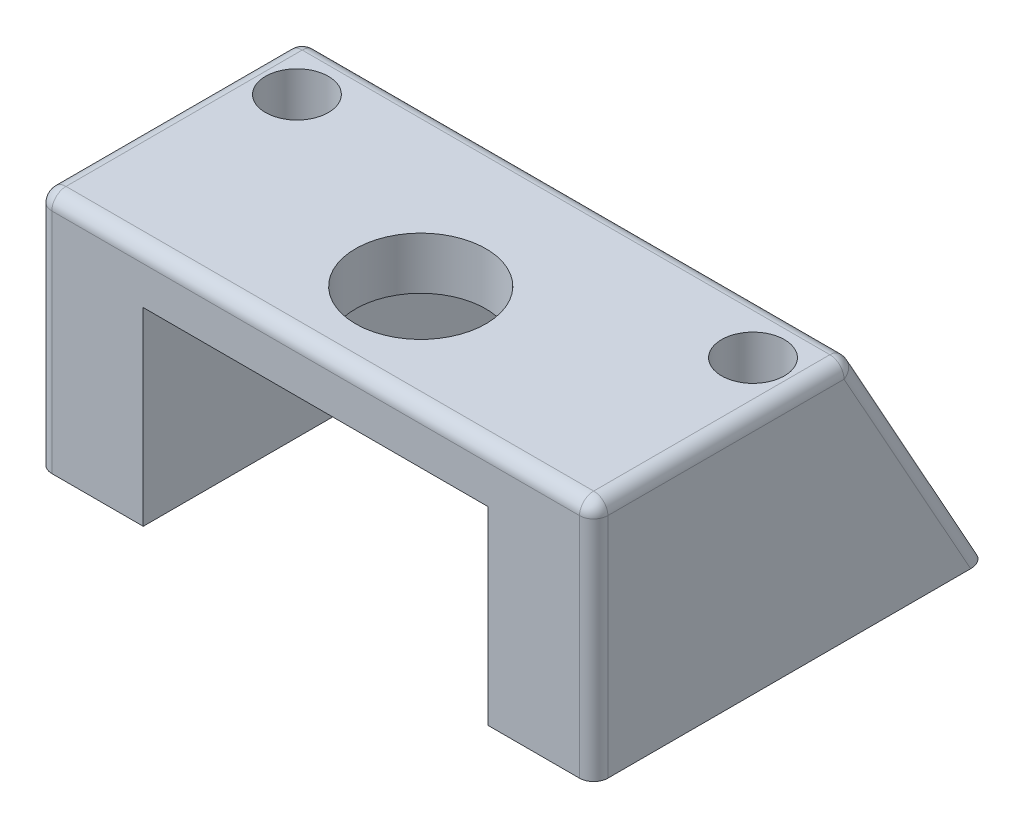
from build123d import *
from build123d.topology import SkipClean

# Parameters (mm, degrees)
BOSS_EXTRUDE1_DEPTH             = 21.336
CUT_EXTRUDE1_DEPTH              = 28.727459508
CUT_EXTRUDE1_DEPTH_BACK         = 28.727459508
SKETCH2_W                       = 26.4668
SKETCH2_H                       = 14.542
FILLET1_R                       = 1.08735749
CUT_EXTRUDE2_DEPTH              = 28.727459508
CUT_EXTRUDE2_DEPTH_BACK         = 28.727459508
SKETCH3_R                       = 5
CUT_EXTRUDE3_START              = -9.271
CUT_EXTRUDE3_DEPTH              = 16.9672
CUT_EXTRUDE4_REACH              = 44.487
CUT_EXTRUDE4_DIRECTION_2_REACH  = 44.487
BOSS_EXTRUDE2_START             = -9.271
BOSS_EXTRUDE2_DEPTH             = 16.9672
BOSS_EXTRUDE3_REACH             = 44.487
BOSS_EXTRUDE3_DIRECTION_2_REACH = 44.487
CUT_EXTRUDE5_START              = -9.271
CUT_EXTRUDE5_DEPTH              = 8.001
CUT_EXTRUDE6_DEPTH              = 2.96394251
CUT_EXTRUDE7_REACH              = 29.727
CUT_EXTRUDE7_DIRECTION_2_REACH  = 29.727
BOSS_EXTRUDE5_START             = 5.271
SKETCH11_W                      = 1.6256
SKETCH11_H                      = 1.117047559
BOSS_EXTRUDE5_DEPTH             = 2.0066
SKETCH14_R                      = 2.413
CUT_EXTRUDE8_DEPTH              = 9.3472
CUT_EXTRUDE9_REACH              = 29.753
SKETCH15_R                      = 1.143


with BuildPart() as part:
    # Sketch1 → Boss-Extrude1 (new, symmetric)
    with BuildSketch(Plane(origin=(0, 0, 0), x_dir=(0, 0, -1), z_dir=(1, 0, 0))):
        Polygon((-15.0876, -9.271), (15.0876, -9.271), (4.76551496, 9.271), (-15.0876, 9.271), align=None)
    extrude(amount=BOSS_EXTRUDE1_DEPTH, both=True)

    # Sketch2 → Cut-Extrude1 (cut, two sides: drawn at the far end of the back side and taken through both)
    with BuildSketch(Plane.XY.offset(-CUT_EXTRUDE1_DEPTH_BACK)):
        with Locations((0, -2)):
            Rectangle(SKETCH2_W, SKETCH2_H)
    extrude(amount=CUT_EXTRUDE1_DEPTH + CUT_EXTRUDE1_DEPTH_BACK, mode=Mode.SUBTRACT)

    # Fillet1
    fillet1_edges = [part.edges().sort_by_distance(p)[0] for p in [
        (21.336, 0, 15.0876),
        (21.336, 0, -9.92655748),
        (-21.336, 0, 15.0876),
        (-21.336, 9.271, 5.16104252),
        (-21.336, 0, -9.92655748),
        (21.336, 9.271, 5.16104252),
        (0, 9.271, 15.0876),
        (0, 9.271, -4.76551496),
    ]]
    fillet(fillet1_edges, radius=FILLET1_R)

    # Sketch3 → Cut-Extrude2 (cut, two sides: drawn at the far end of the back side and taken through both)
    with BuildSketch(Plane(origin=(0, 0, 0), x_dir=(1, 0, 0), z_dir=(0, 1, 0)).offset(-CUT_EXTRUDE2_DEPTH_BACK)):
        with Locations(Location((0, -7.025, 0), (0, 0, 270))):
            Circle(SKETCH3_R)
    extrude(amount=CUT_EXTRUDE2_DEPTH + CUT_EXTRUDE2_DEPTH_BACK, mode=Mode.SUBTRACT)

    # Sketch4 → Cut-Extrude3 (cut)
    with BuildSketch(Plane(origin=(0, 0, 0), x_dir=(1, 0, 0), z_dir=(0, 1, 0)).offset(CUT_EXTRUDE3_START)):
        with BuildLine():
            Line((-20.24864251, -14.00024251), (-14.32075749, -14.00024251))
            Line((-14.32075749, -14.00024251), (-14.32075749, 3.339958947))
            ThreePointArc((-14.32075749, 3.339958947), (-17.174184705, 4.923981914), (-20.24864251, 3.82904592))
            Line((-20.24864251, 3.82904592), (-20.24864251, -14.00024251))
        make_face()
    extrude(amount=CUT_EXTRUDE3_DEPTH, mode=Mode.SUBTRACT)

    # Cut-Extrude4: up to this face of the body (flat: up to its plane)
    cut_extrude4_end = Plane(part.part.faces().sort_by_distance((-14.32075749, -0.7874, 5.330141781))[0])
    # Sketch7 → Cut-Extrude4 (cut, up to the picked face)
    with BuildSketch(Plane.ZY.offset(17.2847), mode=Mode.PRIVATE) as cut_extrude4_sk1:
        Polygon((-3.339958947, -9.271), (-13.843109925, -9.271), (-4.397695121, 7.6962), (-3.339958947, 7.6962), align=None)
    cut_extrude4_tool1 = split(extrude(cut_extrude4_sk1.sketch, amount=-CUT_EXTRUDE4_REACH, mode=Mode.PRIVATE), bisect_by=cut_extrude4_end, keep=Keep.BOTH, mode=Mode.PRIVATE)
    add(cut_extrude4_tool1.solids().sort_by(Axis((-17.2847, -3.097809, -6.873268), (1, 0, 0)))[0], mode=Mode.SUBTRACT)

    # Cut-Extrude4 direction 2: up to this face of the body (flat: up to its plane)
    cut_extrude4_direction_2_end = Plane(part.part.faces().sort_by_distance((-20.24864251, -0.7874, 5.085598295))[0])
    # Sketch7 → Cut-Extrude4 direction 2 (cut, up to the picked face)
    with BuildSketch(Plane.ZY.offset(17.2847), mode=Mode.PRIVATE) as cut_extrude4_direction_2_sk1:
        Polygon((-3.339958947, -9.271), (-13.843109925, -9.271), (-4.397695121, 7.6962), (-3.339958947, 7.6962), align=None)
    cut_extrude4_direction_2_tool1 = split(extrude(cut_extrude4_direction_2_sk1.sketch, amount=CUT_EXTRUDE4_DIRECTION_2_REACH, mode=Mode.PRIVATE), bisect_by=cut_extrude4_direction_2_end, keep=Keep.BOTH, mode=Mode.PRIVATE)
    add(cut_extrude4_direction_2_tool1.solids().sort_by(Axis((-17.2847, -3.097809, -6.873268), (-1, 0, 0)))[0], mode=Mode.SUBTRACT)

    # Sketch4<3> → Boss-Extrude2 (add)
    with BuildSketch(Plane(origin=(0, 0, 0), x_dir=(1, 0, 0), z_dir=(0, 1, 0)).offset(BOSS_EXTRUDE2_START)):
        with BuildLine():
            Line((-20.24864251, 3.82904592), (-20.24864251, -1.87904592))
            ThreePointArc((-20.24864251, -1.87904592), (-17.174184705, -2.973981914), (-14.32075749, -1.389958947))
            Line((-14.32075749, -1.389958947), (-14.32075749, 3.339958947))
            ThreePointArc((-14.32075749, 3.339958947), (-17.174184705, 4.923981914), (-20.24864251, 3.82904592))
        make_face()
    boss_extrude2 = extrude(amount=BOSS_EXTRUDE2_DEPTH)

    # Boss-Extrude3: up to this face of the body (flat: up to its plane)
    boss_extrude3_end = Plane(part.part.faces().sort_by_distance((-14.32075749, -0.7874, 7.695100729))[0])
    # Sketch8 → Boss-Extrude3 (add, up to the picked face)
    with BuildSketch(Plane.ZY.offset(17.2847), mode=Mode.PRIVATE) as boss_extrude3_sk1:
        Polygon((-3.82904592, 7.6962), (-4.397695121, 7.6962), (-13.843109925, -9.271), (-3.339958947, 7.6962), align=None)
    boss_extrude3_tool1 = split(extrude(boss_extrude3_sk1.sketch, amount=-BOSS_EXTRUDE3_REACH, mode=Mode.PRIVATE), bisect_by=boss_extrude3_end, keep=Keep.BOTH, mode=Mode.PRIVATE)
    add(boss_extrude3_tool1.solids().sort_by(Axis((-17.2847, 2.040467, -7.193588), (1, 0, 0)))[0])

    # Boss-Extrude3 direction 2: up to this face of the body (flat: up to its plane)
    boss_extrude3_direction_2_end = Plane(part.part.faces().sort_by_distance((-20.24864251, -0.7874, 7.939644215))[0])
    # Sketch8 → Boss-Extrude3 direction 2 (add, up to the picked face)
    with BuildSketch(Plane.ZY.offset(17.2847), mode=Mode.PRIVATE) as boss_extrude3_direction_2_sk1:
        Polygon((-3.82904592, 7.6962), (-4.397695121, 7.6962), (-13.843109925, -9.271), (-3.339958947, 7.6962), align=None)
    boss_extrude3_direction_2_tool1 = split(extrude(boss_extrude3_direction_2_sk1.sketch, amount=BOSS_EXTRUDE3_DIRECTION_2_REACH, mode=Mode.PRIVATE), bisect_by=boss_extrude3_direction_2_end, keep=Keep.BOTH, mode=Mode.PRIVATE)
    add(boss_extrude3_direction_2_tool1.solids().sort_by(Axis((-17.2847, 2.040467, -7.193588), (-1, 0, 0)))[0])

    # Sketch4<4> → Cut-Extrude5 (cut)
    with BuildSketch(Plane(origin=(0, 0, 0), x_dir=(1, 0, 0), z_dir=(0, 1, 0)).offset(CUT_EXTRUDE5_START)):
        with BuildLine():
            ThreePointArc((-18.111184511, -1.324462975), (-18.042197414, -1.424488299), (-17.932195062, -1.4761))
            ThreePointArc((-17.932195062, -1.4761), (-17.811174423, -1.465223885), (-17.712137081, -1.394825803))
            ThreePointArc((-17.712137081, -1.394825803), (-17.617293446, -1.320975793), (-17.5, -1.294681563))
            ThreePointArc((-17.5, -1.294681563), (-17.382706554, -1.320975793), (-17.287862919, -1.394825803))
            ThreePointArc((-17.287862919, -1.394825803), (-17.188825577, -1.465223885), (-17.067804938, -1.4761))
            ThreePointArc((-17.067804938, -1.4761), (-16.957802586, -1.424488299), (-16.888815489, -1.324462975))
            ThreePointArc((-16.888815489, -1.324462975), (-16.824949816, -1.222628232), (-16.723723187, -1.157803016))
            ThreePointArc((-16.723723187, -1.157803016), (-16.604510244, -1.142394789), (-16.490128189, -1.179352665))
            ThreePointArc((-16.490128189, -1.179352665), (-16.372985968, -1.211632457), (-16.255543916, -1.180461166))
            ThreePointArc((-16.255543916, -1.180461166), (-16.16982776, -1.094339011), (-16.139211769, -0.976750975))
            ThreePointArc((-16.139211769, -0.976750975), (-16.114027201, -0.859214272), (-16.041076813, -0.763676949))
            ThreePointArc((-16.041076813, -0.763676949), (-15.934323215, -0.708424724), (-15.814198904, -0.704032801))
            ThreePointArc((-15.814198904, -0.704032801), (-15.693080884, -0.694300883), (-15.593382664, -0.624841903))
            ThreePointArc((-15.593382664, -0.624841903), (-15.542291336, -0.514596898), (-15.553739192, -0.393629003))
            ThreePointArc((-15.553739192, -0.393629003), (-15.57027336, -0.274567001), (-15.534398108, -0.159840781))
            ThreePointArc((-15.534398108, -0.159840781), (-15.452979913, -0.071408793), (-15.341602111, -0.0261968))
            ThreePointArc((-15.341602111, -0.0261968), (-15.231116913, 0.024373013), (-15.161187602, 0.123741903))
            ThreePointArc((-15.161187602, 0.123741903), (-15.15088347, 0.244812585), (-15.203014393, 0.354569826))
            ThreePointArc((-15.203014393, 0.354569826), (-15.259273031, 0.460796492), (-15.2648, 0.580873933))
            ThreePointArc((-15.2648, 0.580873933), (-15.218537445, 0.691819483), (-15.129339958, 0.77239831))
            ThreePointArc((-15.129339958, 0.77239831), (-15.042813727, 0.857706554), (-15.011087832, 0.975))
            ThreePointArc((-15.011087832, 0.975), (-15.042813727, 1.092293446), (-15.129339958, 1.17760169))
            ThreePointArc((-15.129339958, 1.17760169), (-15.218537445, 1.258180517), (-15.2648, 1.369126067))
            ThreePointArc((-15.2648, 1.369126067), (-15.259273031, 1.489203508), (-15.203014393, 1.595430174))
            ThreePointArc((-15.203014393, 1.595430174), (-15.15088347, 1.705187415), (-15.161187602, 1.826258097))
            ThreePointArc((-15.161187602, 1.826258097), (-15.231116913, 1.925626987), (-15.341602111, 1.9761968))
            ThreePointArc((-15.341602111, 1.9761968), (-15.452979913, 2.021408793), (-15.534398108, 2.109840781))
            ThreePointArc((-15.534398108, 2.109840781), (-15.57027336, 2.224567001), (-15.553739192, 2.343629003))
            ThreePointArc((-15.553739192, 2.343629003), (-15.542291336, 2.464596898), (-15.593382664, 2.574841903))
            ThreePointArc((-15.593382664, 2.574841903), (-15.693080884, 2.644300883), (-15.814198904, 2.654032801))
            ThreePointArc((-15.814198904, 2.654032801), (-15.934323215, 2.658424724), (-16.041076813, 2.713676949))
            ThreePointArc((-16.041076813, 2.713676949), (-16.114027201, 2.809214272), (-16.139211769, 2.926750975))
            ThreePointArc((-16.139211769, 2.926750975), (-16.16982776, 3.044339011), (-16.255543916, 3.130461166))
            ThreePointArc((-16.255543916, 3.130461166), (-16.372985968, 3.161632457), (-16.490128189, 3.129352665))
            ThreePointArc((-16.490128189, 3.129352665), (-16.604510244, 3.092394789), (-16.723723187, 3.107803016))
            ThreePointArc((-16.723723187, 3.107803016), (-16.824949816, 3.172628232), (-16.888815489, 3.274462975))
            ThreePointArc((-16.888815489, 3.274462975), (-16.957802586, 3.374488299), (-17.067804938, 3.4261))
            ThreePointArc((-17.067804938, 3.4261), (-17.188825577, 3.415223885), (-17.287862919, 3.344825803))
            ThreePointArc((-17.287862919, 3.344825803), (-17.382706554, 3.270975793), (-17.5, 3.244681563))
            ThreePointArc((-17.5, 3.244681563), (-17.617293446, 3.270975793), (-17.712137081, 3.344825803))
            ThreePointArc((-17.712137081, 3.344825803), (-17.811174423, 3.415223885), (-17.932195062, 3.4261))
            ThreePointArc((-17.932195062, 3.4261), (-18.042197414, 3.374488299), (-18.111184511, 3.274462975))
            ThreePointArc((-18.111184511, 3.274462975), (-18.175050184, 3.172628232), (-18.276276813, 3.107803016))
            ThreePointArc((-18.276276813, 3.107803016), (-18.395489756, 3.092394789), (-18.509871811, 3.129352665))
            ThreePointArc((-18.509871811, 3.129352665), (-18.627014032, 3.161632457), (-18.744456084, 3.130461166))
            ThreePointArc((-18.744456084, 3.130461166), (-18.83017224, 3.044339011), (-18.860788231, 2.926750975))
            ThreePointArc((-18.860788231, 2.926750975), (-18.885972799, 2.809214272), (-18.958923187, 2.713676949))
            ThreePointArc((-18.958923187, 2.713676949), (-19.065676785, 2.658424724), (-19.185801096, 2.654032801))
            ThreePointArc((-19.185801096, 2.654032801), (-19.306919116, 2.644300883), (-19.406617336, 2.574841903))
            ThreePointArc((-19.406617336, 2.574841903), (-19.457708664, 2.464596898), (-19.446260808, 2.343629003))
            ThreePointArc((-19.446260808, 2.343629003), (-19.42972664, 2.224567001), (-19.465601892, 2.109840781))
            ThreePointArc((-19.465601892, 2.109840781), (-19.547020087, 2.021408793), (-19.658397889, 1.9761968))
            ThreePointArc((-19.658397889, 1.9761968), (-19.768883087, 1.925626987), (-19.838812398, 1.826258097))
            ThreePointArc((-19.838812398, 1.826258097), (-19.84911653, 1.705187415), (-19.796985607, 1.595430174))
            ThreePointArc((-19.796985607, 1.595430174), (-19.740726969, 1.489203508), (-19.7352, 1.369126067))
            ThreePointArc((-19.7352, 1.369126067), (-19.781462555, 1.258180517), (-19.870660042, 1.17760169))
            ThreePointArc((-19.870660042, 1.17760169), (-19.957186273, 1.092293446), (-19.988912168, 0.975))
            ThreePointArc((-19.988912168, 0.975), (-19.957186273, 0.857706554), (-19.870660042, 0.77239831))
            ThreePointArc((-19.870660042, 0.77239831), (-19.781462555, 0.691819483), (-19.7352, 0.580873933))
            ThreePointArc((-19.7352, 0.580873933), (-19.740726969, 0.460796492), (-19.796985607, 0.354569826))
            ThreePointArc((-19.796985607, 0.354569826), (-19.84911653, 0.244812585), (-19.838812398, 0.123741903))
            ThreePointArc((-19.838812398, 0.123741903), (-19.768883087, 0.024373013), (-19.658397889, -0.0261968))
            ThreePointArc((-19.658397889, -0.0261968), (-19.547020087, -0.071408793), (-19.465601892, -0.159840781))
            ThreePointArc((-19.465601892, -0.159840781), (-19.42972664, -0.274567001), (-19.446260808, -0.393629003))
            ThreePointArc((-19.446260808, -0.393629003), (-19.457708664, -0.514596898), (-19.406617336, -0.624841903))
            ThreePointArc((-19.406617336, -0.624841903), (-19.306919116, -0.694300883), (-19.185801096, -0.704032801))
            ThreePointArc((-19.185801096, -0.704032801), (-19.065676785, -0.708424724), (-18.958923187, -0.763676949))
            ThreePointArc((-18.958923187, -0.763676949), (-18.885972799, -0.859214272), (-18.860788231, -0.976750975))
            ThreePointArc((-18.860788231, -0.976750975), (-18.83017224, -1.094339011), (-18.744456084, -1.180461166))
            ThreePointArc((-18.744456084, -1.180461166), (-18.627014032, -1.211632457), (-18.509871811, -1.179352665))
            ThreePointArc((-18.509871811, -1.179352665), (-18.395489756, -1.142394789), (-18.276276813, -1.157803016))
            ThreePointArc((-18.276276813, -1.157803016), (-18.175050184, -1.222628232), (-18.111184511, -1.324462975))
        make_face()
    cut_extrude5 = extrude(amount=CUT_EXTRUDE5_DEPTH, mode=Mode.SUBTRACT)

    # Sketch9 → Cut-Extrude6 (cut, symmetric)
    with BuildSketch(Plane.ZY.offset(-17.2847)):
        Polygon((-13.843109925, -9.271), (-3.339958947, 7.6962), (1.389958947, 7.6962), (14.00024251, 7.6962), (14.00024251, -9.271), align=None)
    extrude(amount=CUT_EXTRUDE6_DEPTH, both=True, mode=Mode.SUBTRACT)

    # Mirror7: Boss-Extrude2 across plane
    add(boss_extrude2.mirror(Plane(origin=(0, 0, 0), x_dir=(0, 0, 1), z_dir=(1, 0, 0))))

    # Mirror8: Cut-Extrude5 across plane
    add(cut_extrude5.mirror(Plane(origin=(0, 0, 0), x_dir=(0, 0, 1), z_dir=(1, 0, 0))), mode=Mode.SUBTRACT)

    # Cut-Extrude7: up to this face of the body (flat: up to its plane)
    cut_extrude7_end = Plane(part.part.faces().sort_by_distance((-13.2334, -2.375473698, 1.919323937))[0])
    # Sketch12 → Cut-Extrude7 (cut, up to the picked face)
    with BuildSketch(Plane(origin=(0, 0, 0), x_dir=(0, 0, -1), z_dir=(1, 0, 0)), mode=Mode.PRIVATE) as cut_extrude7_sk1:
        Polygon((13.843109925, -9.271), (4.630724179, 7.2776), (-14.00024251, 7.2776), (-14.00024251, -9.271), align=None)
    cut_extrude7_tool1 = split(extrude(cut_extrude7_sk1.sketch, amount=-CUT_EXTRUDE7_REACH, mode=Mode.PRIVATE), bisect_by=cut_extrude7_end, keep=Keep.BOTH, mode=Mode.PRIVATE)
    add(cut_extrude7_tool1.solids().sort_by(Axis((0, -1.543425, 2.229485), (-1, 0, 0)))[0], mode=Mode.SUBTRACT)

    # Cut-Extrude7 direction 2: up to this face of the body (flat: up to its plane)
    cut_extrude7_direction_2_end = Plane(part.part.faces().sort_by_distance((13.2334, -2.375473698, 1.919323937))[0])
    # Sketch12 → Cut-Extrude7 direction 2 (cut, up to the picked face)
    with BuildSketch(Plane(origin=(0, 0, 0), x_dir=(0, 0, -1), z_dir=(1, 0, 0)), mode=Mode.PRIVATE) as cut_extrude7_direction_2_sk1:
        Polygon((13.843109925, -9.271), (4.630724179, 7.2776), (-14.00024251, 7.2776), (-14.00024251, -9.271), align=None)
    cut_extrude7_direction_2_tool1 = split(extrude(cut_extrude7_direction_2_sk1.sketch, amount=CUT_EXTRUDE7_DIRECTION_2_REACH, mode=Mode.PRIVATE), bisect_by=cut_extrude7_direction_2_end, keep=Keep.BOTH, mode=Mode.PRIVATE)
    add(cut_extrude7_direction_2_tool1.solids().sort_by(Axis((0, -1.543425, 2.229485), (1, 0, 0)))[0], mode=Mode.SUBTRACT)

    # Sketch11 → Boss-Extrude5 (add)
    with SkipClean():  # the faces are left unmerged after this step: merging them gives an invalid solid
        with BuildSketch(Plane(origin=(0, 0, 0), x_dir=(1, 0, 0), z_dir=(0, 1, 0)).offset(BOSS_EXTRUDE5_START)):
            with BuildLine():
                Line((0.8128, 4.630724179), (-0.8128, 4.630724179))
                Line((-0.8128, 4.630724179), (-0.8128, 0.215895612))
                ThreePointArc((-0.8128, 0.215895612), (0, 0.261371738), (0.8128, 0.215895612))
                Line((0.8128, 0.215895612), (0.8128, 4.630724179))
            make_face()
            with BuildLine():
                ThreePointArc((-0.8128, 0.215895612), (-7.256388658, -6.364669213), (-2.10646743, -14.00024251))
                Line((-2.10646743, -14.00024251), (2.10646743, -14.00024251))
                ThreePointArc((2.10646743, -14.00024251), (5.849774263, -11.369117192), (7.286371738, -7.025))
                ThreePointArc((7.286371738, -7.025), (5.432015098, -2.168620167), (0.8128, 0.215895612))
                Line((0.8128, 0.215895612), (0.8128, -2.091506698))
                ThreePointArc((0.8128, -2.091506698), (3.812086043, -3.789571126), (5, -7.025))
                ThreePointArc((5, -7.025), (-3.235428874, -10.837086043), (-0.8128, -2.091506698))
                Line((-0.8128, -2.091506698), (-0.8128, 0.215895612))
            make_face()
            with BuildLine():
                ThreePointArc((0.8128, 0.215895612), (0, 0.261371738), (-0.8128, 0.215895612))
                Line((-0.8128, 0.215895612), (-0.8128, -2.091506698))
                ThreePointArc((-0.8128, -2.091506698), (0, -2.025), (0.8128, -2.091506698))
                Line((0.8128, -2.091506698), (0.8128, 0.215895612))
            make_face()
            with Locations((0, 5.189247959)):
                Rectangle(SKETCH11_W, SKETCH11_H)
        extrude(amount=BOSS_EXTRUDE5_DEPTH)

    # Sketch14 → Cut-Extrude8 (cut)
    with SkipClean():  # the faces are left unmerged after this step: merging them gives an invalid solid
        with BuildSketch(Plane(origin=(0, 9.271, 0), x_dir=(1, 0, 0), z_dir=(0, 1, 0))):
            with Locations(Location((-17.5, 0.975, 0), (0, 0, 270))):
                Circle(SKETCH14_R)
            with Locations(Location((17.5, 0.975, 0), (0, 0, 90))):
                Circle(SKETCH14_R)
        extrude(amount=-CUT_EXTRUDE8_DEPTH, mode=Mode.SUBTRACT)

    # Sketch15 → Cut-Extrude9 (cut, up to next)
    with BuildSketch(Plane(origin=(0, -0.0762, 0), x_dir=(1, 0, 0), z_dir=(0, 1, 0)), mode=Mode.PRIVATE) as cut_extrude9_sk1:
        with Locations(Location((-17.5, 0.975, 0), (0, 0, 270))):
            Circle(SKETCH15_R)
    cut_extrude9_tool1 = extrude(cut_extrude9_sk1.sketch, amount=-CUT_EXTRUDE9_REACH, mode=Mode.PRIVATE) & part.part
    # Sketch15 → Cut-Extrude9 (cut, up to next)
    with BuildSketch(Plane(origin=(0, -0.0762, 0), x_dir=(1, 0, 0), z_dir=(0, 1, 0)), mode=Mode.PRIVATE) as cut_extrude9_sk2:
        with Locations(Location((17.5, 0.975, 0), (0, 0, 270))):
            Circle(SKETCH15_R)
    cut_extrude9_tool2 = extrude(cut_extrude9_sk2.sketch, amount=-CUT_EXTRUDE9_REACH, mode=Mode.PRIVATE) & part.part
    add(cut_extrude9_tool1.solids().sort_by_distance((-17.5, -0.0762, -0.975))[0], mode=Mode.SUBTRACT)
    add(cut_extrude9_tool2.solids().sort_by_distance((17.5, -0.0762, -0.975))[0], mode=Mode.SUBTRACT)


solid = part.part
